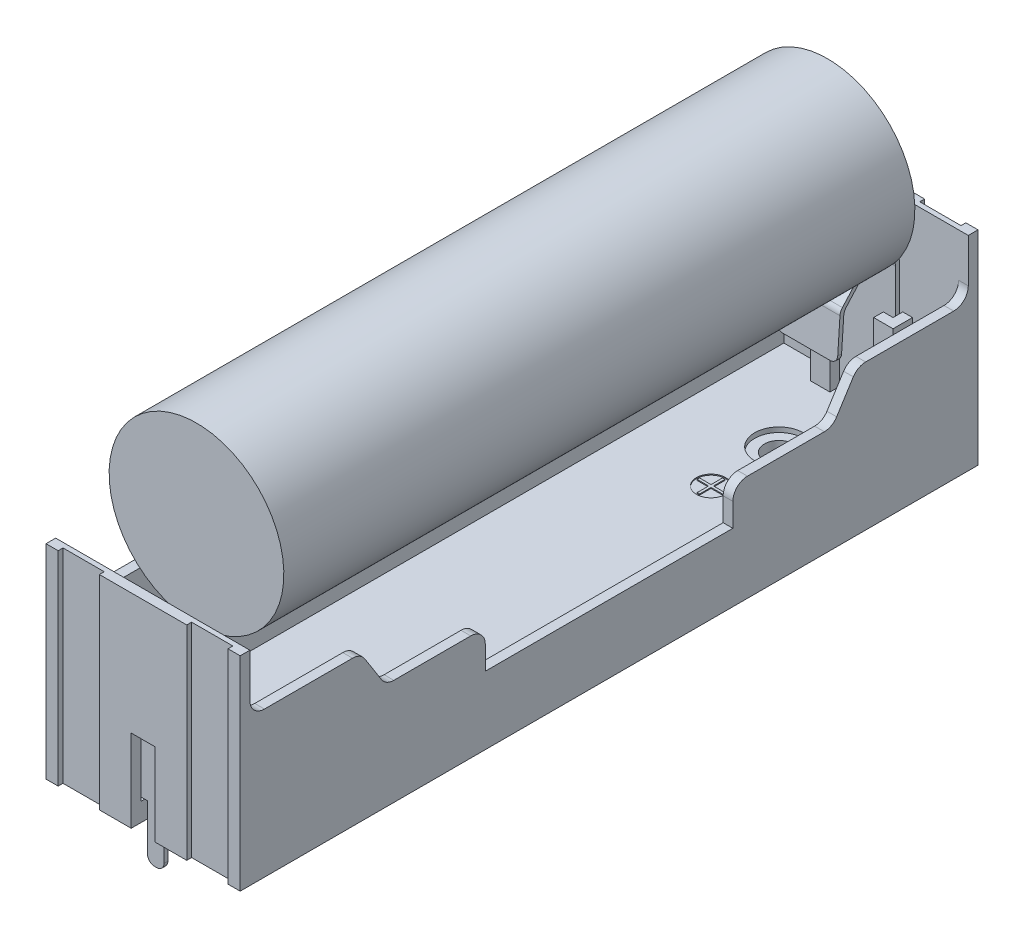
from build123d import *

# Parameters (mm, degrees)
SKETCH_1_W                  = 20
SKETCH_1_H                  = 76
EXTRUDE_780_DEPTH           = 21
CUT_EXTRUDE_1895_DEPTH      = 45.55333882
SKETCH_3_W                  = 18
SKETCH_3_H                  = 74
CUT_EXTRUDE_2456_DEPTH      = 19.1
CUT_EXTRUDE_2748_DEPTH      = 15
CUT_EXTRUDE_2748_DEPTH_BACK = 15
SKETCH_4_W                  = 74
SKETCH_4_H                  = 12
CUT_EXTRUDE_3347_DEPTH      = 15
FILLET_2_R                  = 1.5
FILLET_2_OF_MIRROR_2_R      = 1.5
SKETCH_6_W                  = 2.45
SKETCH_6_H                  = 7
CUT_EXTRUDE_4471_DEPTH      = 8.5
SKETCH_11_R                 = 1.5
CUT_EXTRUDE_4812_DEPTH      = 45.55333882
EXTRUDE_START               = -0.3
SKETCH_12_R                 = 2.8
SKETCH_12_R_2               = 1.5
EXTRUDE_5233_DEPTH          = 0.3
CUT_EXTRUDE_START           = -0.5
SKETCH_13_R                 = 2.5
SKETCH_13_R_2               = 1.5
CUT_EXTRUDE_17_DEPTH        = 0.5
SKETCH_14_R                 = 1.5
SKETCH_14_W                 = 0.25
SKETCH_14_H                 = 2.6
CUT_EXTRUDE_8132_DEPTH      = 0.1
EXTRUDE_9544_DEPTH          = 8.9
EXTRUDE_10391_DEPTH         = 3.2
SKETCH_17_W                 = 1.7
SKETCH_17_H                 = 0.4
EXTRUDE_10843_DEPTH         = 5.5
FILLET_3_R                  = 1
FILLET_4_R                  = 0.75
SKETCH_18_R                 = 9
EXTRUDE_1_DEPTH             = 32.5


with BuildPart() as part:
    # Эскиз1 → Extrude 780 (new body)
    with BuildSketch(Plane(origin=(0, 0, 0), x_dir=(1, 0, 0), z_dir=(0, 1, 0))):
        Rectangle(SKETCH_1_W, SKETCH_1_H)
    extrude(amount=EXTRUDE_780_DEPTH)

    # Эскиз2 → Cut-Extrude 1895 (cut, through all)
    with BuildSketch(Plane(origin=(0, 0, 0), x_dir=(1, 0, 0), z_dir=(0, 1, 0))):
        Polygon((-4.5, 37.5), (-4.5, 38), (4.5, 38), (4.5, 37.5), (8.75, 37.5), (8.75, 38), (10, 38), (10, 46.507054696), (-10, 46.507054696), (-10, 38), (-8.75, 38), (-8.75, 37.5), align=None)
    cut_extrude_1895 = extrude(amount=CUT_EXTRUDE_1895_DEPTH, mode=Mode.SUBTRACT)

    # Зеркальное отражение1: Cut-Extrude 1895 across plane
    add(cut_extrude_1895.mirror(Plane.XY), mode=Mode.SUBTRACT)

    # Эскиз3 → Cut-Extrude 2456 (cut)
    with BuildSketch(Plane(origin=(0, 21, 0), x_dir=(1, 0, 0), z_dir=(0, 1, 0))):
        Rectangle(SKETCH_3_W, SKETCH_3_H)
    extrude(amount=-CUT_EXTRUDE_2456_DEPTH, mode=Mode.SUBTRACT)

    # Эскиз4 → Cut-Extrude 2748 (cut, two sides: drawn at the far end of the back side and taken through both)
    with BuildSketch(Plane(origin=(0, 0, 0), x_dir=(0, 0, -1), z_dir=(1, 0, 0)).offset(-CUT_EXTRUDE_2748_DEPTH_BACK)):
        with Locations((0, 21)):
            Rectangle(SKETCH_4_W, SKETCH_4_H)
    extrude(amount=CUT_EXTRUDE_2748_DEPTH + CUT_EXTRUDE_2748_DEPTH_BACK, mode=Mode.SUBTRACT)

    # Эскиз5 → Cut-Extrude 3347 (cut)
    with BuildSketch(Plane(origin=(10, 0, 0), x_dir=(0, 0, -1), z_dir=(1, 0, 0))):
        Polygon((35.6, 21), (-35.6, 21), (-35.6, 15), (-25.6, 15), (-23, 10.9), (-12.75, 10.9), (-12.75, 7), (12.75, 7), (12.75, 10.9), (23, 10.9), (25.6, 15), (35.6, 15), align=None)
    cut_extrude_3347 = extrude(amount=-CUT_EXTRUDE_3347_DEPTH, mode=Mode.SUBTRACT)

    # Скругление2
    fillet_2_edges = [part.edges().sort_by_distance(p)[0] for p in [
        (9.5, 10.9, -23),
        (9.5, 10.9, -12.75),
        (9.5, 10.9, 12.75),
        (9.5, 10.9, 23),
        (9.5, 15, -37),
        (9.5, 15, -25.6),
        (9.5, 15, 37),
        (9.5, 15, 25.6),
    ]]
    fillet(fillet_2_edges, radius=FILLET_2_R)

    # Зеркальное отражение2: Cut-Extrude 3347 across plane
    add(cut_extrude_3347.mirror(Plane(origin=(0, 0, 0), x_dir=(0, 0, 1), z_dir=(1, 0, 0))), mode=Mode.SUBTRACT)

    # Скругление2 of Зеркальное отражение2
    fillet_2_of_mirror_2_edges = [part.edges().sort_by_distance(p)[0] for p in [
        (-9.5, 10.9, -23),
        (-9.5, 10.9, -12.75),
        (-9.5, 10.9, 12.75),
        (-9.5, 10.9, 23),
        (-9.5, 15, -37),
        (-9.5, 15, -25.6),
        (-9.5, 15, 37),
        (-9.5, 15, 25.6),
    ]]
    fillet(fillet_2_of_mirror_2_edges, radius=FILLET_2_OF_MIRROR_2_R)

    # Эскиз6 → Cut-Extrude 4471 (cut)
    with BuildSketch(Plane(origin=(0, 0, 0), x_dir=(1, 0, 0), z_dir=(0, 1, 0))):
        with Locations((0, -38)):
            Rectangle(SKETCH_6_W, SKETCH_6_H)
        with Locations((0, 38)):
            Rectangle(SKETCH_6_W, SKETCH_6_H)
    extrude(amount=CUT_EXTRUDE_4471_DEPTH, mode=Mode.SUBTRACT)

    # Эскиз11 → Cut-Extrude 4812 (cut, through all)
    with BuildSketch(Plane(origin=(0, 0, 0), x_dir=(1, 0, 0), z_dir=(0, 1, 0))):
        with Locations((0, 27.5)):
            Circle(SKETCH_11_R)
        with Locations((0, -27.5)):
            Circle(SKETCH_11_R)
    extrude(amount=CUT_EXTRUDE_4812_DEPTH, mode=Mode.SUBTRACT)

    # Эскиз12 → Extrude 5233 (add)
    # profile 1 of 2: a face of its own
    with BuildSketch(Plane(origin=(0, 0, 0), x_dir=(1, 0, 0), z_dir=(0, 1, 0)).offset(EXTRUDE_START)):
        with Locations((0, 27.5)):
            Circle(SKETCH_12_R)
        with Locations((0, 27.5)):
            Circle(SKETCH_12_R_2, mode=Mode.SUBTRACT)
    # profile 2 of 2: a face of its own
    with BuildSketch(Plane(origin=(0, 0, 0), x_dir=(1, 0, 0), z_dir=(0, 1, 0)).offset(EXTRUDE_START)):
        with Locations((0, -27.5)):
            Circle(SKETCH_12_R)
        with Locations((0, -27.5)):
            Circle(SKETCH_12_R_2, mode=Mode.SUBTRACT)
    extrude(amount=EXTRUDE_5233_DEPTH)

    # Эскиз13 → Вырез-Вытянуть17 (cut)
    # profile 1 of 2: a face of its own
    with BuildSketch(Plane(origin=(0, 1.9, 0), x_dir=(1, 0, 0), z_dir=(0, 1, 0)).offset(CUT_EXTRUDE_START)):
        with Locations((0, -27.5)):
            Circle(SKETCH_13_R)
        with Locations((0, -27.5)):
            Circle(SKETCH_13_R_2, mode=Mode.SUBTRACT)
    # profile 2 of 2: a face of its own
    with BuildSketch(Plane(origin=(0, 1.9, 0), x_dir=(1, 0, 0), z_dir=(0, 1, 0)).offset(CUT_EXTRUDE_START)):
        with Locations((0, 27.5)):
            Circle(SKETCH_13_R)
        with Locations((0, 27.5)):
            Circle(SKETCH_13_R_2, mode=Mode.SUBTRACT)
    extrude(amount=CUT_EXTRUDE_17_DEPTH, mode=Mode.SUBTRACT)

    # Эскиз14 → Cut-Extrude 8132 (cut)
    # profile 1 of 2: a face of its own
    with BuildSketch(Plane(origin=(0, 1.9, 0), x_dir=(1, 0, 0), z_dir=(0, 1, 0))):
        with Locations((0, 20.5)):
            Circle(SKETCH_14_R)
        Polygon((-0.125, 21.8), (0.125, 21.8), (0.125, 20.625), (1.3, 20.625), (1.3, 20.375), (0.125, 20.375), (0.125, 19.2), (-0.125, 19.2), (-0.125, 20.375), (-1.3, 20.375), (-1.3, 20.625), (-0.125, 20.625), align=None, mode=Mode.SUBTRACT)
    # profile 2 of 2: a face of its own
    with BuildSketch(Plane(origin=(0, 1.9, 0), x_dir=(1, 0, 0), z_dir=(0, 1, 0))):
        with Locations((0, -20.5)):
            Circle(SKETCH_14_R)
        with Locations((0, -20.5)):
            Rectangle(SKETCH_14_W, SKETCH_14_H, mode=Mode.SUBTRACT)
    extrude(amount=-CUT_EXTRUDE_8132_DEPTH, mode=Mode.SUBTRACT)

    # Эскиз15 → Extrude 9544 (add)
    with BuildSketch(Plane(origin=(0, 1.9, 0), x_dir=(1, 0, 0), z_dir=(0, 1, 0))):
        Polygon((-2.25, 35), (-4.25, 35), (-4.25, 37), (-3.25, 37), (-3.25, 36), (-2.25, 36), align=None)
        Polygon((2.25, 35), (2.25, 36), (3.25, 36), (3.25, 37), (4.25, 37), (4.25, 35), align=None)
        Polygon((4.25, -35), (2.25, -35), (2.25, -36), (3.25, -36), (3.25, -37), (4.25, -37), align=None)
        Polygon((-2.25, -36), (-2.25, -35), (-4.25, -35), (-4.25, -37), (-3.25, -37), (-3.25, -36), align=None)
    extrude(amount=EXTRUDE_9544_DEPTH)


with BuildPart() as body_2:
    # Эскиз16 → Extrude 10391 (new, symmetric)
    with BuildSketch(Plane.ZY):
        Polygon((-36.3, 2), (-36.3, 15.826972516), (-33.848539634, 17.01426896), (-30.994965619, 13.823876222), (-30.699555061, 9.402575836), (-30.300444939, 9.429242503), (-30.605034381, 13.987919845), (-33.751460366, 17.50573104), (-36.7, 16.077688118), (-36.7, 2), align=None)
    extrude(amount=EXTRUDE_10391_DEPTH, both=True)

    # Эскиз17 → Extrude 10843 (add)
    with BuildSketch(Plane.XZ.offset(-2)):
        with Locations((0, -36.5)):
            Rectangle(SKETCH_17_W, SKETCH_17_H)
    extrude(amount=EXTRUDE_10843_DEPTH)

    # Скругление3
    fillet_3_edges = [body_2.edges().sort_by_distance(p)[0] for p in [
        (0, 13.823876222, -30.994965619),
        (0, 13.987919845, -30.605034381),
        (0, 17.01426896, -33.848539634),
        (0, 17.50573104, -33.751460366),
        (0, 15.826972516, -36.3),
        (0, 16.077688118, -36.7),
    ]]
    fillet(fillet_3_edges, radius=FILLET_3_R)

    # Скругление4
    fillet_4_edges = [body_2.edges().sort_by_distance(p)[0] for p in [
        (3.2, 2, -36.5),
        (0.85, -3.5, -36.5),
        (-0.85, -3.5, -36.5),
        (-3.2, 2, -36.5),
        (3.2, 9.41590917, -30.5),
        (-3.2, 9.41590917, -30.5),
    ]]
    fillet(fillet_4_edges, radius=FILLET_4_R)


with BuildPart() as body_3:
    # Mirror1: mirrored copy
    add(body_2.part.mirror(Plane.XY))


with BuildPart() as body_2_1:
    add(body_2.part)

    add(body_3.part)  # Бобышка-Вытянуть1 merges body 3
    # Эскиз18 → Бобышка-Вытянуть1 (add, symmetric)
    with BuildSketch(Plane.XY):
        with Locations((0, 25.02)):
            Circle(SKETCH_18_R)
    extrude(amount=EXTRUDE_1_DEPTH, both=True)


solid = Compound([part.part, body_2_1.part])
